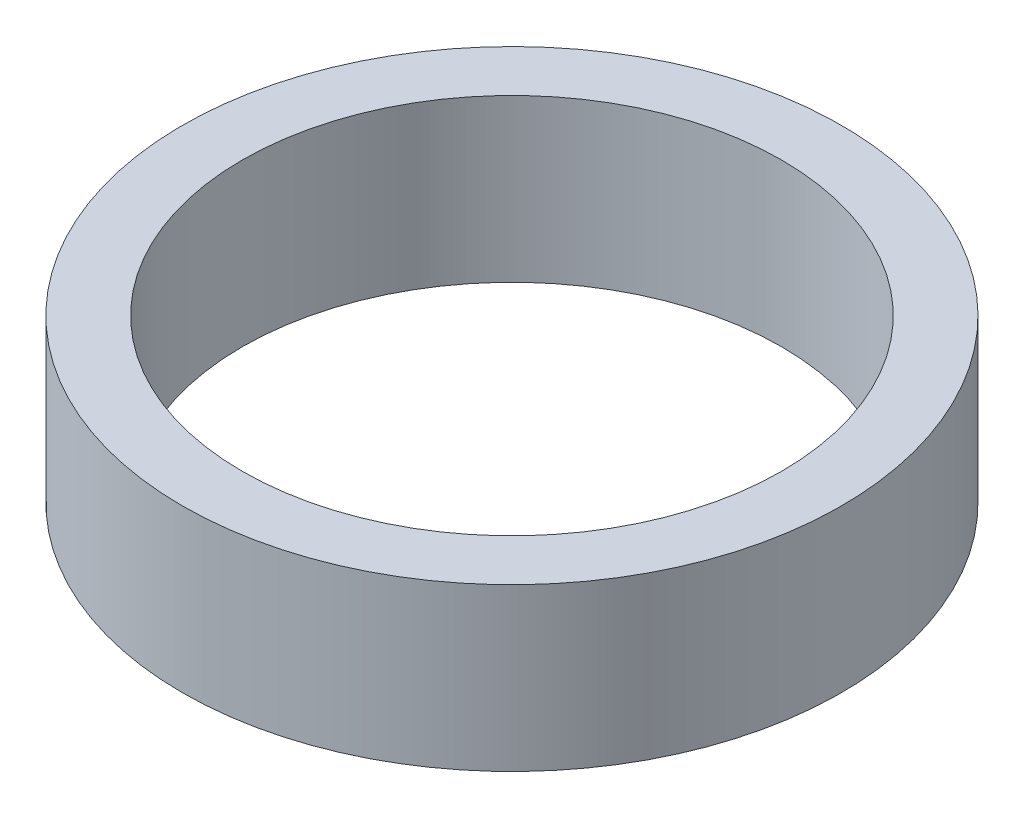
from build123d import *

# Parameters (mm, degrees)
SKETCH1_R           = 55
BOSS_EXTRUDE1_DEPTH = 27
SKETCH2_R           = 45
CUT_EXTRUDE1_DEPTH  = 83.33468285


with BuildPart() as part:
    # Sketch1 → Boss-Extrude1 (new body)
    with BuildSketch(Plane(origin=(0, 0, 0), x_dir=(1, 0, 0), z_dir=(0, 1, 0))):
        Circle(SKETCH1_R)
    extrude(amount=BOSS_EXTRUDE1_DEPTH)

    # Sketch2 → Cut-Extrude1 (cut, through all)
    with BuildSketch(Plane(origin=(0, 0, 0), x_dir=(1, 0, 0), z_dir=(0, 1, 0))):
        Circle(SKETCH2_R)
    extrude(amount=CUT_EXTRUDE1_DEPTH, mode=Mode.SUBTRACT)


solid = part.part
